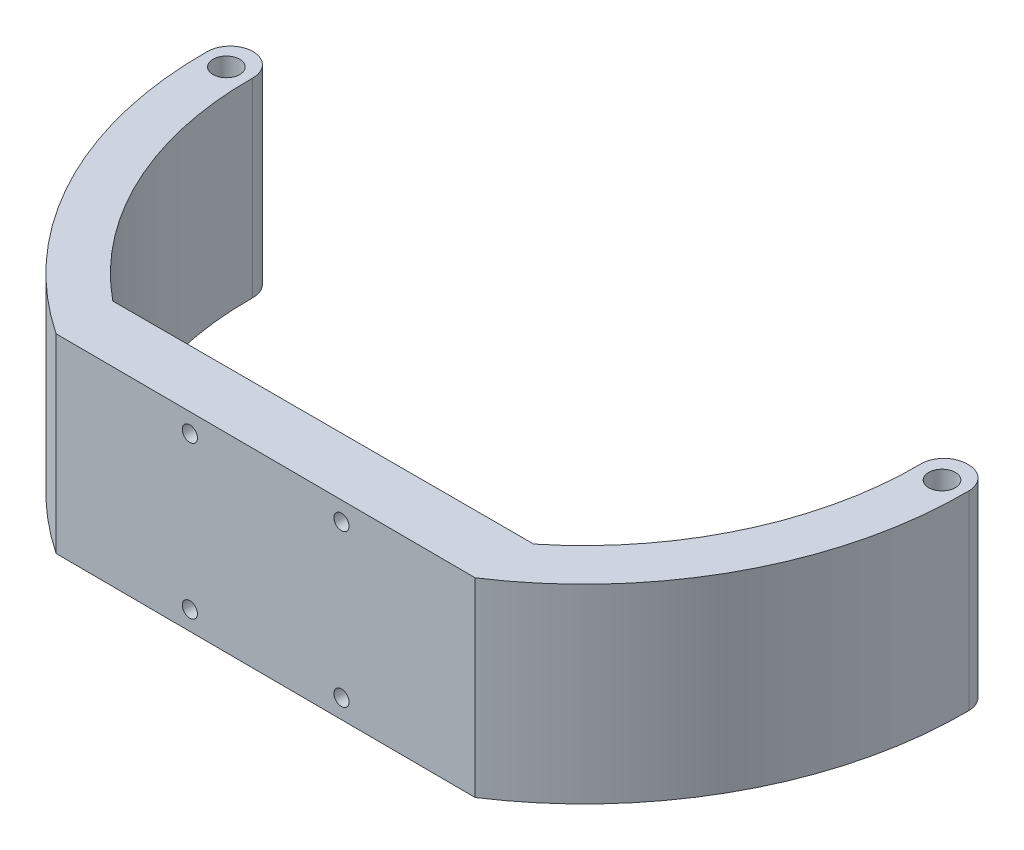
from build123d import *

# Parameters (mm, degrees)
SKETCH1_R           = 1.75
BOSS_EXTRUDE1_DEPTH = 25
FILLET2_R           = 3
FILLET3_R           = 3
SKETCH2_R           = 1
CUT_EXTRUDE1_DEPTH  = 10


with BuildPart() as part:
    # Sketch1 → Boss-Extrude1 (new body)
    with BuildSketch(Plane(origin=(0, 0, 0), x_dir=(1, 0, 0), z_dir=(0, 1, 0))):
        with BuildLine():
            Line((49.859310292, 3.748223209), (43.664405044, 3.223270017))
            ThreePointArc((43.664405044, 3.223270017), (40.162533858, -17.433892609), (27.463538801, -34.098735665))
            Line((27.463538801, -34.098735665), (-27.821692195, -34.098735665))
            ThreePointArc((-27.821692195, -34.098735665), (-40.425237601, -17.394553614), (-43.88915269, 3.242315021))
            Line((-43.88915269, 3.242315021), (-49.859310292, 3.748223209))
            ThreePointArc((-49.859310292, 3.748223209), (-44.960475989, -21.875913669), (-27.821692195, -41.544595839))
            Line((-27.821692195, -41.544595839), (27.463538801, -41.782221537))
            ThreePointArc((27.463538801, -41.782221537), (44.866035011, -22.06895789), (49.859310292, 3.748223209))
        make_face()
        with Locations(Location((-47, 0, 0), (0, 0, 270))):
            Circle(SKETCH1_R, mode=Mode.SUBTRACT)
        with Locations(Location((47, 0, 0), (0, 0, 90))):
            Circle(SKETCH1_R, mode=Mode.SUBTRACT)
    extrude(amount=BOSS_EXTRUDE1_DEPTH)

    # Fillet2
    fillet2_edges = [part.edges().sort_by_distance(p)[0] for p in [
        (43.664405044, 12.5, -3.223270017),
        (49.859310292, 12.5, -3.748223209),
        (-43.88915269, 12.5, -3.242315021),
    ]]
    fillet(fillet2_edges, radius=FILLET2_R)

    # Fillet3
    # the kernel refuses this fillet: 3 mm, written as the material it takes off along each edge
    with BuildSketch(Plane(origin=(-49.859310292, -8.061567981, -3.748223209), x_dir=(-0.04276994163543241, 0, 0.9990849473856073), z_dir=(0, 1, 0))) as fillet3_piece_1:
        with BuildLine():
            CenterArc((3.127888377, 2.998439861), FILLET3_R, 177.607640596, 94.240255032)
            Line((0.13050316, 3.123667112), (0, 0))
            ThreePointArc((0, 0), (1.612313596, -0.026002313), (3.224627192, 0))
        make_face()
    extrude(amount=41.123135962, mode=Mode.SUBTRACT)

    # Sketch2 → Cut-Extrude1 (cut)
    with BuildSketch(Plane(origin=(-0.179076697, 0, 41.663408688), x_dir=(0.9999907629660516, 0, 0.004298137105095237), z_dir=(-0.004298137105095237, 0, 0.9999907629660516))):
        with Locations((10, 2.5)):
            Circle(SKETCH2_R)
        with Locations((-10, 2.5)):
            Circle(SKETCH2_R)
        with Locations((10, 22.5)):
            Circle(SKETCH2_R)
        with Locations((-10, 22.5)):
            Circle(SKETCH2_R)
    extrude(amount=-CUT_EXTRUDE1_DEPTH, mode=Mode.SUBTRACT)


solid = part.part
